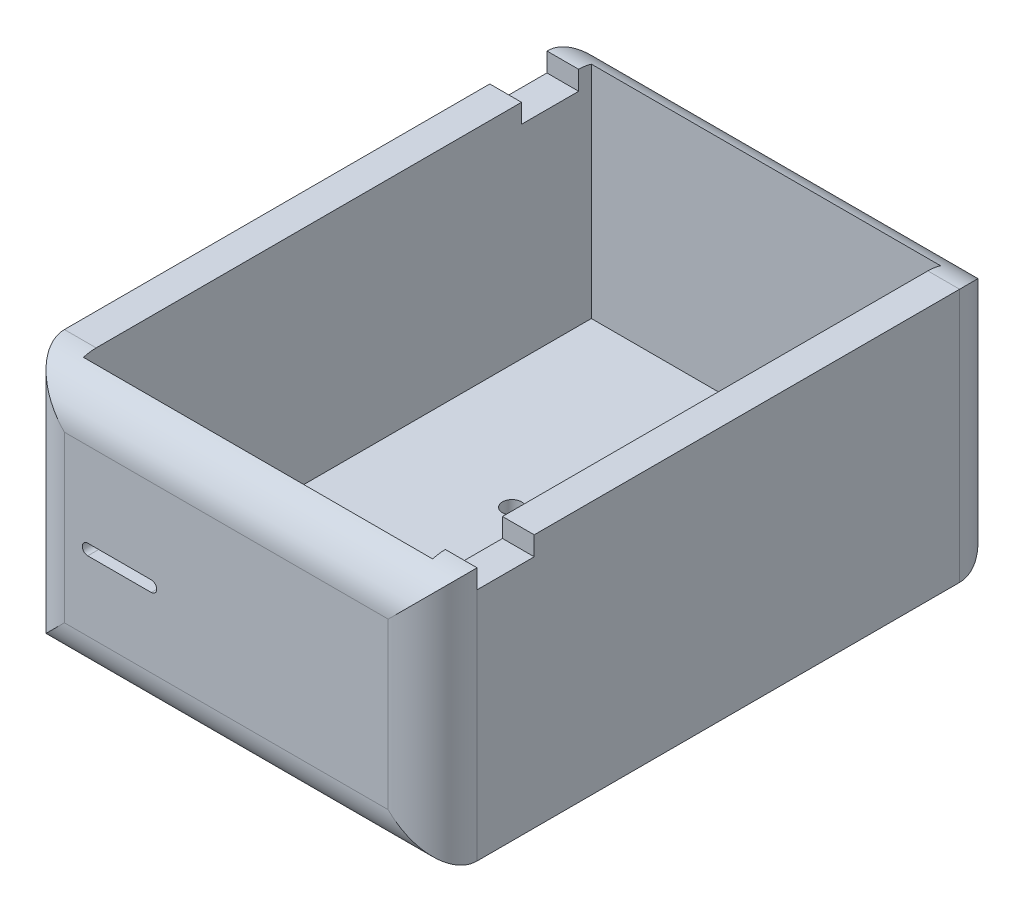
from build123d import *

# Parameters (mm, degrees)
ESBO_O3_W                = 65
ESBO_O3_H                = 90
RESSALTO_EXTRUS_O2_DEPTH = 40
CASCA2_T                 = -5
ESBO_O4_R                = 1.5
CORTE_EXTRUS_O1_DEPTH    = 40
FILETE2_R                = 7
ESBO_O5_W                = 5
ESBO_O5_H                = 9
CORTE_EXTRUS_O2_DEPTH    = 3
ESBO_O7_W                = 5
ESBO_O7_H                = 9
CORTE_EXTRUS_O3_DEPTH    = 3
CORTE_EXTRUS_O4_REACH    = 105.712


with BuildPart() as part:
    # Esboço3 → Ressalto-extrusão2 (new body)
    with BuildSketch(Plane(origin=(0, 0, 0), x_dir=(1, 0, 0), z_dir=(0, 1, 0))):
        Rectangle(ESBO_O3_W, ESBO_O3_H)
    extrude(amount=RESSALTO_EXTRUS_O2_DEPTH)

    # Casca2
    casca2_openings = [part.faces().sort_by_distance(p)[0] for p in [
        (0, 40, 0),
    ]]
    offset(amount=CASCA2_T, openings=casca2_openings, kind=Kind.INTERSECTION)

    # Esboço4 → Corte-extrusão1 (cut)
    with BuildSketch(Plane(origin=(0, 5, 0), x_dir=(1, 0, 0), z_dir=(0, 1, 0))):
        with Locations(Location((-8, 8, 0), (0, 0, 270))):
            Circle(ESBO_O4_R)
        with Locations(Location((8, 8, 0), (0, 0, 90))):
            Circle(ESBO_O4_R)
        with Locations(Location((8, -8, 0), (0, 0, 270))):
            Circle(ESBO_O4_R)
        with Locations(Location((-8, -8, 0), (0, 0, 90))):
            Circle(ESBO_O4_R)
    extrude(amount=-CORTE_EXTRUS_O1_DEPTH, mode=Mode.SUBTRACT)

    # Filete2
    # the kernel refuses this fillet: 7 mm, written as the material it takes off along each edge
    with BuildSketch(Plane(origin=(32.5, -17.5, -45), x_dir=(0, 0, 1), z_dir=(0, 1, 0)), Plane(origin=(32.5, -17.5, 45), x_dir=(-1, 0, 0), z_dir=(0, 1, 0))) as filete2_piece_1:
        with BuildLine():
            CenterArc((FILETE2_R, -FILETE2_R), FILETE2_R, 90, 90)
            Line((0, -FILETE2_R), (0, 0))
            Line((0, 0), (FILETE2_R, 0))
        make_face()
    extrude(amount=75, mode=Mode.SUBTRACT)
    with BuildSketch(Plane(origin=(50, 40, -45), x_dir=(0, 0, 1), z_dir=(-1, 0, 0)), Plane(origin=(-50, 0, 45), x_dir=(0, 1, 0), z_dir=(1, 0, 0))) as filete2_piece_2:
        with BuildLine():
            CenterArc((FILETE2_R, -FILETE2_R), FILETE2_R, 90, 90)
            Line((0, -FILETE2_R), (0, 0))
            Line((0, 0), (FILETE2_R, 0))
        make_face()
    extrude(amount=100, mode=Mode.SUBTRACT)
    with BuildSketch(Plane(origin=(-32.5, -17.5, -45), x_dir=(0, 0, 1), z_dir=(0, 1, 0)), Plane(origin=(-32.5, -17.5, 45), x_dir=(1, 0, 0), z_dir=(0, 1, 0))) as filete2_piece_3:
        with BuildLine():
            CenterArc((FILETE2_R, FILETE2_R), FILETE2_R, 180, 90)
            Line((0, FILETE2_R), (0, 0))
            Line((0, 0), (FILETE2_R, 0))
        make_face()
    extrude(amount=75, mode=Mode.SUBTRACT)
    with BuildSketch(Plane(origin=(50, 0, -45), x_dir=(0, 0, 1), z_dir=(-1, 0, 0)), Plane(origin=(-50, 40, 45), x_dir=(0, -1, 0), z_dir=(1, 0, 0))) as filete2_piece_4:
        with BuildLine():
            CenterArc((FILETE2_R, FILETE2_R), FILETE2_R, 180, 90)
            Line((0, FILETE2_R), (0, 0))
            Line((0, 0), (FILETE2_R, 0))
        make_face()
    extrude(amount=100, mode=Mode.SUBTRACT)

    # Esboço5 → Corte-extrusão2 (cut)
    with BuildSketch(Plane(origin=(0, 40, 0), x_dir=(1, 0, 0), z_dir=(0, 1, 0))):
        with Locations((-30, 33.5)):
            Rectangle(ESBO_O5_W, ESBO_O5_H)
    extrude(amount=-CORTE_EXTRUS_O2_DEPTH, mode=Mode.SUBTRACT)

    # Esboço7 → Corte-extrusão3 (cut)
    with BuildSketch(Plane(origin=(0, 40, 0), x_dir=(1, 0, 0), z_dir=(0, 1, 0))):
        with Locations((30, -33.5)):
            Rectangle(ESBO_O7_W, ESBO_O7_H)
    extrude(amount=-CORTE_EXTRUS_O3_DEPTH, mode=Mode.SUBTRACT)

    # Esboço8 → Corte-extrusão4 (cut, up to next)
    with BuildSketch(Plane.XY.offset(45), mode=Mode.PRIVATE) as corte_extrus_o4_sk1:
        with BuildLine():
            Line((-21.8264162, 19.698053531), (-11.8264162, 19.698053531))
            ThreePointArc((-11.8264162, 19.698053531), (-10.963712002, 18.835349333), (-11.8264162, 17.972645136))
            Line((-11.8264162, 17.972645136), (-21.8264162, 17.972645136))
            ThreePointArc((-21.8264162, 17.972645136), (-22.689120398, 18.835349333), (-21.8264162, 19.698053531))
        make_face()
    corte_extrus_o4_tool1 = extrude(corte_extrus_o4_sk1.sketch, amount=-CORTE_EXTRUS_O4_REACH, mode=Mode.PRIVATE) & part.part
    add(corte_extrus_o4_tool1.solids().sort_by_distance((-16.826416, 18.835349, 45))[0], mode=Mode.SUBTRACT)


solid = part.part
